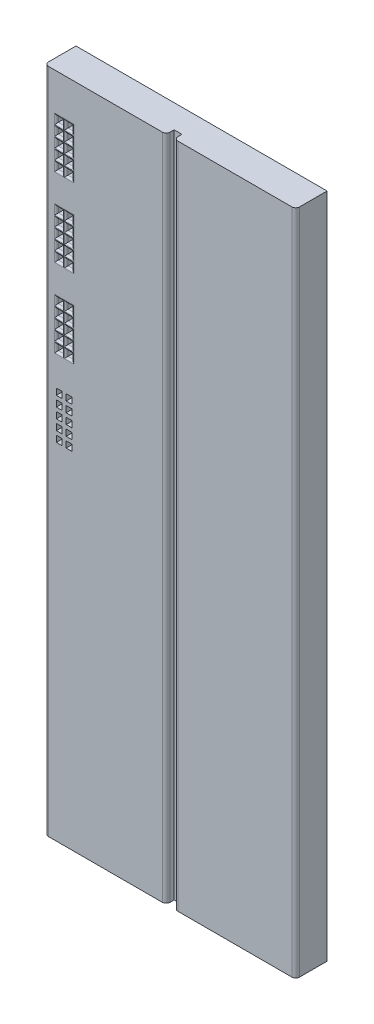
from build123d import *

# Parameters (mm, degrees)
ESBO_O1_W                = 64
ESBO_O1_H                = 170
RESSALTO_EXTRUS_O1_DEPTH = 8
ESBO_O3_W                = 2
ESBO_O3_H                = 2
CORTE_EXTRUS_O1_DEPTH    = 182.824090813
FILETE1_R                = 1
ESBO_O2_W                = 1.5
ESBO_O2_H                = 1.6
CORTE_EXTRUS_O2_DEPTH    = 4
FILETE2_R                = 0.5
ESBO_O2_7_W              = 1.5
ESBO_O2_7_H              = 1.6
CORTE_EXTRUS_O3_DEPTH    = 4
FILETE3_R                = 0.5


with BuildPart() as part:
    # Esboço1 → Ressalto-extrusão1 (new body)
    with BuildSketch(Plane.XY):
        with Locations((32, 85)):
            Rectangle(ESBO_O1_W, ESBO_O1_H)
    extrude(amount=RESSALTO_EXTRUS_O1_DEPTH)

    # Esboço3 → Corte-extrusão1 (cut, through all)
    with BuildSketch(Plane.XZ):
        with Locations((32, 7)):
            Rectangle(ESBO_O3_W, ESBO_O3_H)
    extrude(amount=-CORTE_EXTRUS_O1_DEPTH, mode=Mode.SUBTRACT)

    # Filete1
    filete1_edges = [part.edges().sort_by_distance(p)[0] for p in [
        (64, 85, 8),
        (31, 85, 8),
        (33, 85, 8),
        (0, 85, 8),
    ]]
    fillet(filete1_edges, radius=FILETE1_R)

    # Esboço2 → Corte-extrusão2 (cut, symmetric)
    with BuildSketch(Plane.XY.offset(8)):
        with Locations((3.75, 148.8)):
            Rectangle(ESBO_O2_W, ESBO_O2_H)
        with Locations((6.25, 148.8)):
            Rectangle(ESBO_O2_W, ESBO_O2_H)
        with Locations((6.25, 151.4)):
            Rectangle(ESBO_O2_W, ESBO_O2_H)
        with Locations((3.75, 151.4)):
            Rectangle(ESBO_O2_W, ESBO_O2_H)
        with Locations((3.75, 154)):
            Rectangle(ESBO_O2_W, ESBO_O2_H)
        with Locations((6.25, 154)):
            Rectangle(ESBO_O2_W, ESBO_O2_H)
        with Locations((6.25, 156.6)):
            Rectangle(ESBO_O2_W, ESBO_O2_H)
        with Locations((3.75, 156.6)):
            Rectangle(ESBO_O2_W, ESBO_O2_H)
        with Locations((3.75, 159.2)):
            Rectangle(ESBO_O2_W, ESBO_O2_H)
        with Locations((6.25, 159.2)):
            Rectangle(ESBO_O2_W, ESBO_O2_H)
    extrude(amount=CORTE_EXTRUS_O2_DEPTH, both=True, mode=Mode.SUBTRACT)

    # Filete2
    filete2_edges = [part.edges().sort_by_distance(p)[0] for p in [
        (3, 154, 8),
        (3.75, 153.2, 8),
        (4.5, 154, 8),
        (3.75, 154.8, 8),
        (5.5, 154, 8),
        (6.25, 153.2, 8),
        (7, 154, 8),
        (6.25, 154.8, 8),
        (5.5, 156.6, 8),
        (6.25, 155.8, 8),
        (7, 156.6, 8),
        (6.25, 157.4, 8),
        (3, 156.6, 8),
        (3.75, 155.8, 8),
        (4.5, 156.6, 8),
        (3.75, 157.4, 8),
        (3.75, 158.4, 8),
        (4.5, 159.2, 8),
        (3.75, 160, 8),
        (3, 159.2, 8),
        (6.25, 158.4, 8),
        (7, 159.2, 8),
        (6.25, 160, 8),
        (5.5, 159.2, 8),
        (3, 148.8, 8),
        (3.75, 148, 8),
        (4.5, 148.8, 8),
        (3.75, 149.6, 8),
        (5.5, 148.8, 8),
        (6.25, 148, 8),
        (7, 148.8, 8),
        (6.25, 149.6, 8),
        (6.25, 150.6, 8),
        (7, 151.4, 8),
        (6.25, 152.2, 8),
        (5.5, 151.4, 8),
        (3.75, 150.6, 8),
        (4.5, 151.4, 8),
        (3.75, 152.2, 8),
        (3, 151.4, 8),
    ]]
    fillet(filete2_edges, radius=FILETE2_R - 0.0001)  # a hair under: the kernel refuses the full size

    # Esboço2<7> → Corte-extrusão3 (cut, symmetric)
    with BuildSketch(Plane.XY.offset(8)):
        with Locations((3.75, 128.8)):
            Rectangle(ESBO_O2_7_W, ESBO_O2_7_H)
        with Locations((6.25, 128.8)):
            Rectangle(ESBO_O2_7_W, ESBO_O2_7_H)
        with Locations((3.75, 131.4)):
            Rectangle(ESBO_O2_7_W, ESBO_O2_7_H)
        with Locations((6.25, 131.4)):
            Rectangle(ESBO_O2_7_W, ESBO_O2_7_H)
        with Locations((3.75, 134)):
            Rectangle(ESBO_O2_7_W, ESBO_O2_7_H)
        with Locations((6.25, 134)):
            Rectangle(ESBO_O2_7_W, ESBO_O2_7_H)
        with Locations((3.75, 136.6)):
            Rectangle(ESBO_O2_7_W, ESBO_O2_7_H)
        with Locations((6.25, 136.6)):
            Rectangle(ESBO_O2_7_W, ESBO_O2_7_H)
        with Locations((3.75, 139.2)):
            Rectangle(ESBO_O2_7_W, ESBO_O2_7_H)
        with Locations((6.25, 139.2)):
            Rectangle(ESBO_O2_7_W, ESBO_O2_7_H)
        with Locations((3.75, 108.8)):
            Rectangle(ESBO_O2_7_W, ESBO_O2_7_H)
        with Locations((6.25, 108.8)):
            Rectangle(ESBO_O2_7_W, ESBO_O2_7_H)
        with Locations((3.75, 111.4)):
            Rectangle(ESBO_O2_7_W, ESBO_O2_7_H)
        with Locations((6.25, 111.4)):
            Rectangle(ESBO_O2_7_W, ESBO_O2_7_H)
        with Locations((3.75, 114)):
            Rectangle(ESBO_O2_7_W, ESBO_O2_7_H)
        with Locations((6.25, 114)):
            Rectangle(ESBO_O2_7_W, ESBO_O2_7_H)
        with Locations((3.75, 116.6)):
            Rectangle(ESBO_O2_7_W, ESBO_O2_7_H)
        with Locations((6.25, 116.6)):
            Rectangle(ESBO_O2_7_W, ESBO_O2_7_H)
        with Locations((3.75, 119.2)):
            Rectangle(ESBO_O2_7_W, ESBO_O2_7_H)
        with Locations((6.25, 119.2)):
            Rectangle(ESBO_O2_7_W, ESBO_O2_7_H)
        with Locations((6.25, 88.8)):
            Rectangle(ESBO_O2_7_W, ESBO_O2_7_H)
        with Locations((3.75, 88.8)):
            Rectangle(ESBO_O2_7_W, ESBO_O2_7_H)
        with Locations((3.75, 91.4)):
            Rectangle(ESBO_O2_7_W, ESBO_O2_7_H)
        with Locations((6.25, 91.4)):
            Rectangle(ESBO_O2_7_W, ESBO_O2_7_H)
        with Locations((3.75, 94)):
            Rectangle(ESBO_O2_7_W, ESBO_O2_7_H)
        with Locations((6.25, 94)):
            Rectangle(ESBO_O2_7_W, ESBO_O2_7_H)
        with Locations((3.75, 96.6)):
            Rectangle(ESBO_O2_7_W, ESBO_O2_7_H)
        with Locations((6.25, 96.6)):
            Rectangle(ESBO_O2_7_W, ESBO_O2_7_H)
        with Locations((3.75, 99.2)):
            Rectangle(ESBO_O2_7_W, ESBO_O2_7_H)
        with Locations((6.25, 99.2)):
            Rectangle(ESBO_O2_7_W, ESBO_O2_7_H)
    extrude(amount=CORTE_EXTRUS_O3_DEPTH, both=True, mode=Mode.SUBTRACT)

    # Filete3
    filete3_edges = [part.edges().sort_by_distance(p)[0] for p in [
        (3.75, 129.6, 8),
        (3, 128.8, 8),
        (3.75, 128, 8),
        (4.5, 128.8, 8),
        (5.5, 128.8, 8),
        (6.25, 128, 8),
        (7, 128.8, 8),
        (6.25, 129.6, 8),
        (3.75, 132.2, 8),
        (3, 131.4, 8),
        (3.75, 130.6, 8),
        (4.5, 131.4, 8),
        (6.25, 130.6, 8),
        (7, 131.4, 8),
        (6.25, 132.2, 8),
        (5.5, 131.4, 8),
        (3.75, 134.8, 8),
        (3, 134, 8),
        (3.75, 133.2, 8),
        (4.5, 134, 8),
        (5.5, 134, 8),
        (6.25, 133.2, 8),
        (7, 134, 8),
        (6.25, 134.8, 8),
        (3.75, 137.4, 8),
        (3, 136.6, 8),
        (3.75, 135.8, 8),
        (4.5, 136.6, 8),
        (6.25, 135.8, 8),
        (7, 136.6, 8),
        (6.25, 137.4, 8),
        (5.5, 136.6, 8),
        (3.75, 140, 8),
        (3, 139.2, 8),
        (3.75, 138.4, 8),
        (4.5, 139.2, 8),
        (6.25, 138.4, 8),
        (7, 139.2, 8),
        (6.25, 140, 8),
        (5.5, 139.2, 8),
        (3.75, 109.6, 8),
        (3, 108.8, 8),
        (3.75, 108, 8),
        (4.5, 108.8, 8),
        (5.5, 108.8, 8),
        (6.25, 108, 8),
        (7, 108.8, 8),
        (6.25, 109.6, 8),
        (3.75, 112.2, 8),
        (3, 111.4, 8),
        (3.75, 110.6, 8),
        (4.5, 111.4, 8),
        (6.25, 110.6, 8),
        (7, 111.4, 8),
        (6.25, 112.2, 8),
        (5.5, 111.4, 8),
        (3.75, 114.8, 8),
        (3, 114, 8),
        (3.75, 113.2, 8),
        (4.5, 114, 8),
        (5.5, 114, 8),
        (6.25, 113.2, 8),
        (7, 114, 8),
        (6.25, 114.8, 8),
        (3.75, 117.4, 8),
        (3, 116.6, 8),
        (3.75, 115.8, 8),
        (4.5, 116.6, 8),
        (6.25, 115.8, 8),
        (7, 116.6, 8),
        (6.25, 117.4, 8),
        (5.5, 116.6, 8),
        (3.75, 120, 8),
        (3, 119.2, 8),
        (3.75, 118.4, 8),
        (4.5, 119.2, 8),
        (6.25, 118.4, 8),
        (7, 119.2, 8),
        (6.25, 120, 8),
        (5.5, 119.2, 8),
    ]]
    fillet(filete3_edges, radius=FILETE3_R - 0.0001)  # a hair under: the kernel refuses the full size


solid = part.part
